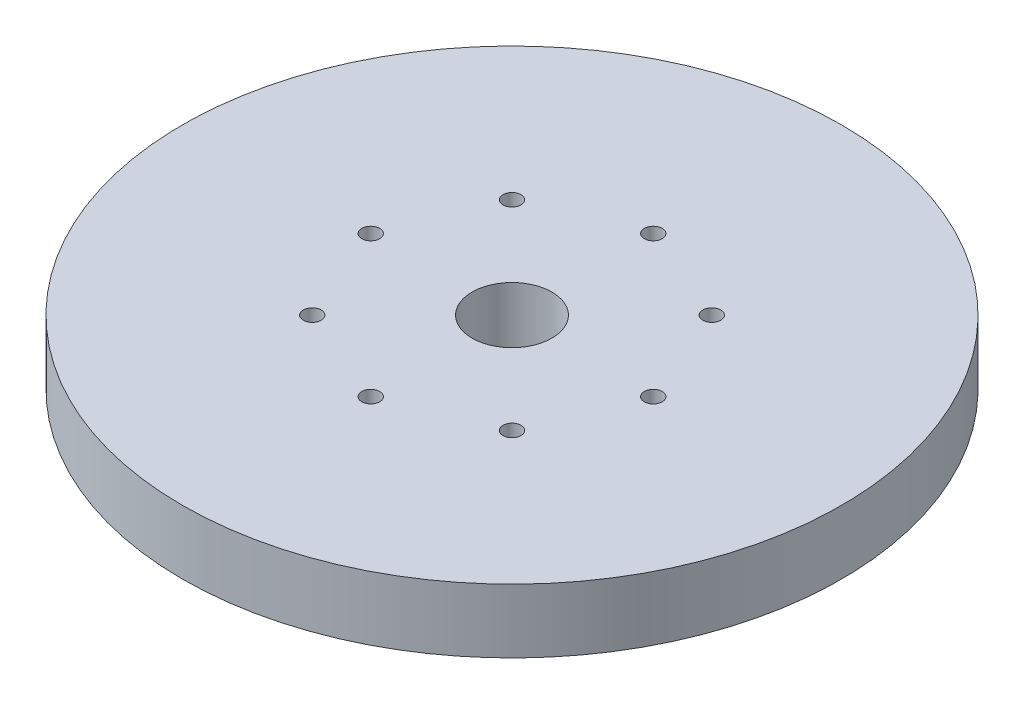
from build123d import *

# Parameters (mm, degrees)
SKETCH1_R           = 82.5
BOSS_EXTRUDE1_DEPTH = 16
SKETCH2_R           = 10
CUT_EXTRUDE1_DEPTH  = 118.764595698
SKETCH3_R           = 2.243495609
CUT_EXTRUDE2_DEPTH  = 10.981072853
CIRPATTERN1_COUNT   = 8


with BuildPart() as part:
    # Sketch1 → Boss-Extrude1 (new body)
    with BuildSketch(Plane(origin=(0, 0, 0), x_dir=(1, 0, 0), z_dir=(0, 1, 0))):
        Circle(SKETCH1_R)
    extrude(amount=BOSS_EXTRUDE1_DEPTH)

    # Sketch2 → Cut-Extrude1 (cut, through all)
    with BuildSketch(Plane(origin=(0, 0, 0), x_dir=(1, 0, 0), z_dir=(0, 1, 0))):
        Circle(SKETCH2_R)
    extrude(amount=CUT_EXTRUDE1_DEPTH, mode=Mode.SUBTRACT)

    # Sketch3 → Cut-Extrude2 (cut)
    with BuildSketch(Plane(origin=(0, 16, 0), x_dir=(1, 0, 0), z_dir=(0, 1, 0))):
        with Locations((-35.360496959, 0)):
            Circle(SKETCH3_R)
    cut_extrude2 = extrude(amount=-CUT_EXTRUDE2_DEPTH, mode=Mode.SUBTRACT)

    # CirPattern1: Cut-Extrude2 ×8 about axis
    cirpattern1_axis = Axis((0, 0, 0), (0, 1, 0))
    for i in range(1, CIRPATTERN1_COUNT):
        add(cut_extrude2.rotate(cirpattern1_axis, i * 360 / CIRPATTERN1_COUNT), mode=Mode.SUBTRACT)


solid = part.part
